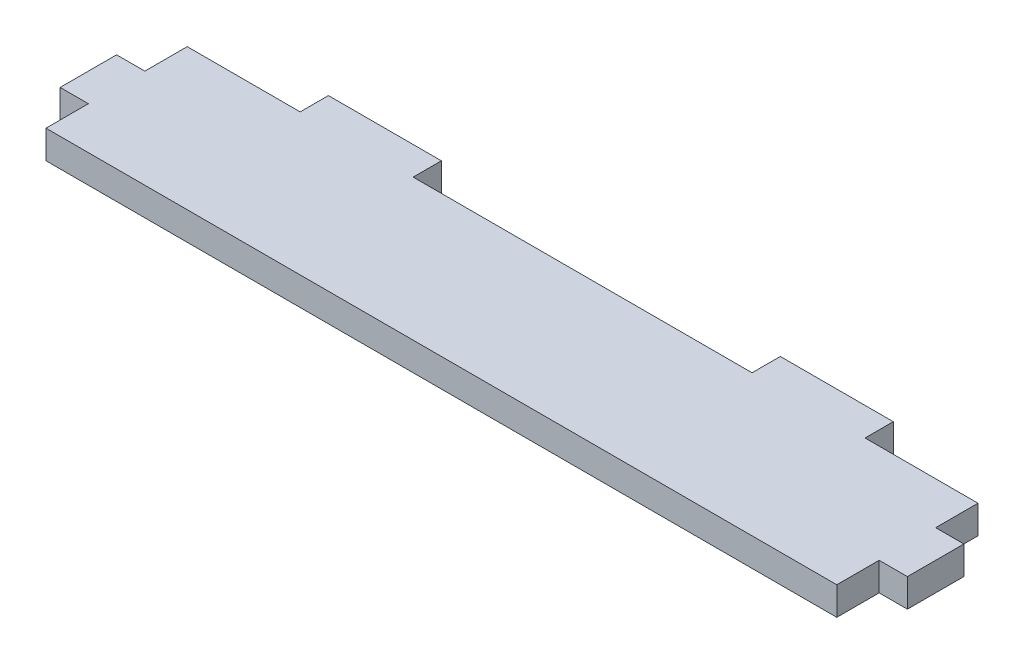
from build123d import *

# Parameters (mm, degrees)
BOSS_EXTRUDE1_DEPTH = 5


with BuildPart() as part:
    # Sketch1 → Boss-Extrude1 (new body)
    with BuildSketch(Plane(origin=(0, 0, 0), x_dir=(1, 0, 0), z_dir=(0, 1, 0))):
        Polygon((-70, 12.5), (-50, 12.5), (-50, 17.5), (-30, 17.5), (-30, 12.5), (30, 12.5), (30, 17.5), (50, 17.5), (50, 12.5), (70, 12.5), (70, 5), (75, 5), (75, -5), (70, -5), (70, -12.5), (-70, -12.5), (-70, -5), (-75, -5), (-75, 5), (-70, 5), align=None)
    extrude(amount=BOSS_EXTRUDE1_DEPTH)


solid = part.part
